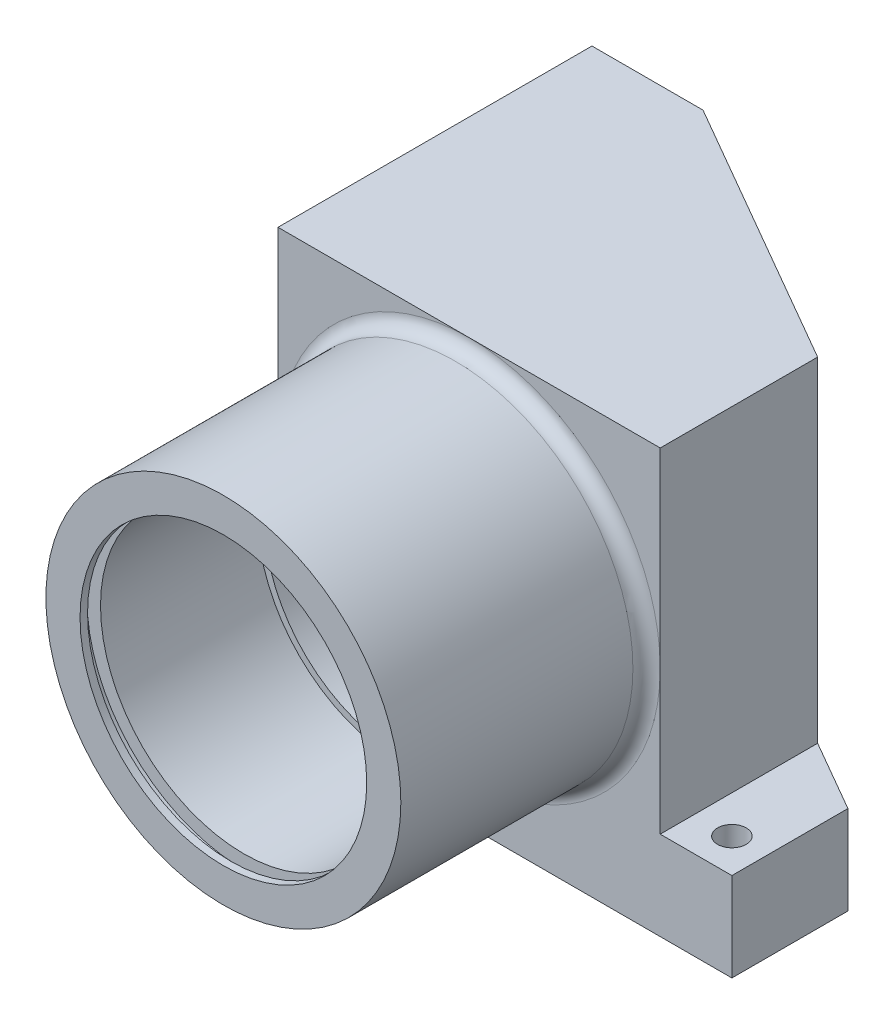
from build123d import *

# Parameters (mm, degrees)
SKETCH_1_W          = 56
SKETCH_1_H          = 62
EXTRUDE_1_DEPTH     = 82
SKETCH_4_W          = 56
SKETCH_4_H          = 62
SKETCH_4_R          = 26
CUT_EXTRUDE_1_DEPTH = 36
SKETCH_15_W         = 23
SKETCH_15_H         = 1.9
FILLET_1_R          = 2
SKETCH_19_W         = 10.5
SKETCH_19_H         = 46
EXTRUDE_2_DEPTH     = 13
CUT_EXTRUDE_2_DEPTH = 110.773630713
HOLE_WIZARD_M5_1_D  = 4.2


with BuildPart() as part:
    # 草图1 → 凸台-拉伸1 (new body)
    with BuildSketch(Plane.XY):
        with Locations((0, -3)):
            Rectangle(SKETCH_1_W, SKETCH_1_H)
    extrude(amount=EXTRUDE_1_DEPTH)

    # 草图3 → 切除-旋转2 (revolve, cut)
    with BuildSketch(Plane(origin=(0, 0, 0), x_dir=(0, 0, -1), z_dir=(1, 0, 0)), mode=Mode.PRIVATE) as cut_revolve_2_sk:
        Polygon((-82, 0), (0, 0), (0, 23), (-52, 23), (-52, 20), (-56, 20), (-56, 21), (-82, 21), align=None)
    revolve(cut_revolve_2_sk.sketch.rotate(Axis((0, 0, -5.719261836), (0, 0, 1)), 90), axis=Axis((0, 0, -5.719261836), (0, 0, 1)), mode=Mode.SUBTRACT)

    # 草图4 → 切除-拉伸1 (cut)
    with BuildSketch(Plane.XY.offset(82)):
        with Locations((0, -3)):
            Rectangle(SKETCH_4_W, SKETCH_4_H)
        Circle(SKETCH_4_R, mode=Mode.SUBTRACT)
    extrude(amount=-CUT_EXTRUDE_1_DEPTH, mode=Mode.SUBTRACT)

    # 草图15 → 切除-旋转3 (revolve, cut)
    with BuildSketch(Plane(origin=(0, 0, 0), x_dir=(1, 0, 0), z_dir=(0, 1, 0))):
        with Locations((-11.5, -79.95)):
            Rectangle(SKETCH_15_W, SKETCH_15_H)
    revolve(axis=Axis((0, 0, 0), (0, 0, 1)), mode=Mode.SUBTRACT)

    # 圆角1
    fillet_1_edges = [part.edges().sort_by_distance(p)[0] for p in [
        (-26, 0, 46),
    ]]
    fillet(fillet_1_edges, radius=FILLET_1_R - 0.0001)  # a hair under: the kernel refuses the full size

    # 草图19 → 凸台-拉伸2 (add)
    with BuildSketch(Plane.XZ.offset(34)):
        with Locations((33.25, 23)):
            Rectangle(SKETCH_19_W, SKETCH_19_H)
        with Locations((-33.25, 23)):
            Rectangle(SKETCH_19_W, SKETCH_19_H)
    extrude(amount=-EXTRUDE_2_DEPTH)

    # 草图25 → 切除-拉伸2 (cut, through all)
    with BuildSketch(Plane.XZ.offset(34)):
        Polygon((213.716550827, 130.161322786), (38.5, 29), (-11.729473419, 0), (-186.946024246, -101.161322786), (15.376621326, -451.59442444), (416.039196399, -220.271778867), align=None)
    extrude(amount=-CUT_EXTRUDE_2_DEPTH, mode=Mode.SUBTRACT)

    # M5 螺纹孔1 (through all)
    with Locations(Plane(origin=(0, -34, 0), x_dir=(-1, 0, 0), z_dir=(0, -1, 0))):
        with Locations((33.5, -5), (-33.5, -41), (33.5, -41)):
            Hole(HOLE_WIZARD_M5_1_D / 2)


solid = part.part
